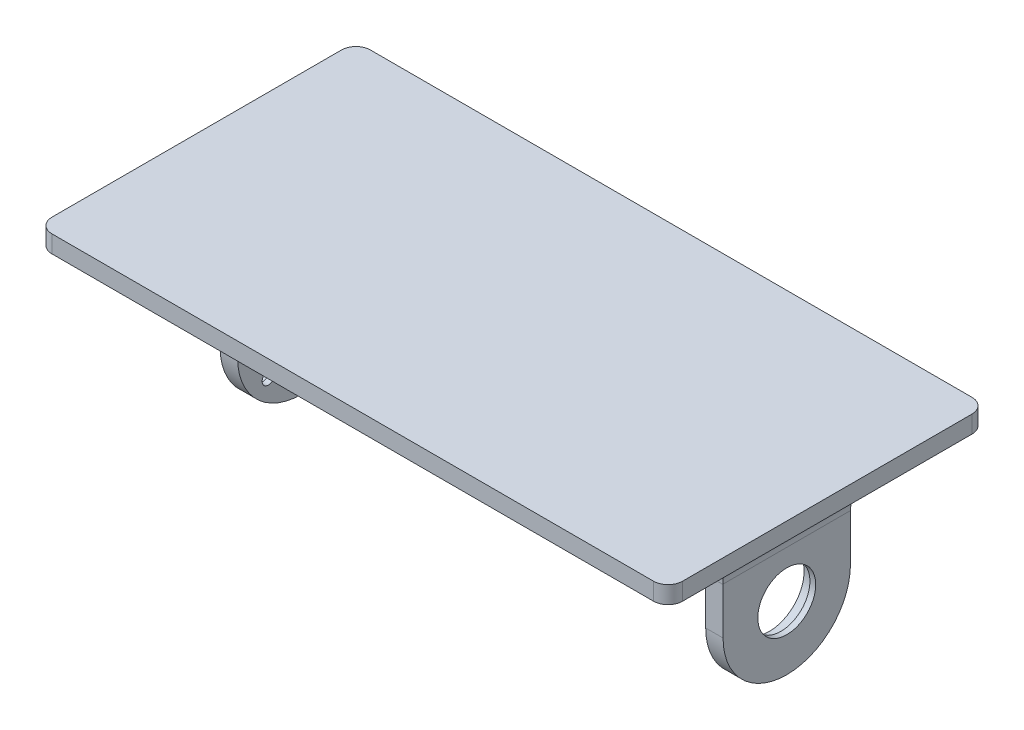
from build123d import *

# Parameters (mm, degrees)
SKETCH1_W           = 108.9
SKETCH1_H           = 55
BOSS_EXTRUDE1_DEPTH = 3
SKETCH5_W           = 3
SKETCH5_H           = 22
BOSS_EXTRUDE2_DEPTH = 27
SKETCH2_R           = 3
SKETCH2_R_2         = 1.1
CUT_EXTRUDE1_DEPTH  = 3
CIRPATTERN1_COUNT   = 4
FILLET3_R           = 11
SKETCH6_R           = 2
CUT_EXTRUDE5_DEPTH  = 2
CIRPATTERN2_COUNT   = 4
SKETCH7_R           = 5
CUT_EXTRUDE6_DEPTH  = 10
SKETCH7_5_R         = 6
SKETCH7_5_R_2       = 5
CUT_EXTRUDE7_DEPTH  = 2
FILLET4_R           = 8
FILETE1_R           = 2.5


# Some blends are built 0.0001 mm under size
with BuildPart() as part:
    # Sketch1 → Boss-Extrude1 (new body)
    with BuildSketch(Plane(origin=(0, 0, 0), x_dir=(1, 0, 0), z_dir=(0, 1, 0))):
        with Locations((-4.025, 0)):
            Rectangle(SKETCH1_W, SKETCH1_H)
    extrude(amount=BOSS_EXTRUDE1_DEPTH)

    # Sketch5 → Boss-Extrude2 (add)
    with BuildSketch(Plane.XZ):
        with Locations((-41.925, 0)):
            Rectangle(SKETCH5_W, SKETCH5_H)
        with Locations((41.925, 0)):
            Rectangle(SKETCH5_W, SKETCH5_H)
    extrude(amount=BOSS_EXTRUDE2_DEPTH)

    # Sketch2 → Cut-Extrude1 (cut)
    with BuildSketch(Plane.ZY.offset(43.425)):
        with Locations((0, -16)):
            Circle(SKETCH2_R)
        with Locations((-5.656854249, -21.656854249)):
            Circle(SKETCH2_R_2)
    cut_extrude1 = extrude(amount=-CUT_EXTRUDE1_DEPTH, mode=Mode.SUBTRACT)

    # CirPattern1: Cut-Extrude1 ×4 about axis
    cirpattern1_axis = Axis((0, -16, 0), (1, 0, 0))
    for i in range(1, CIRPATTERN1_COUNT):
        add(cut_extrude1.rotate(cirpattern1_axis, i * 360 / CIRPATTERN1_COUNT), mode=Mode.SUBTRACT)

    # Fillet3
    fillet3_edges = [part.edges().sort_by_distance(p)[0] for p in [
        (-41.925, -27, -11),
        (-41.925, -27, 11),
        (41.925, -27, -11),
        (41.925, -27, 11),
    ]]
    fillet(fillet3_edges, radius=FILLET3_R - 0.0001)  # a hair under: the kernel refuses the full size

    # Sketch6 → Cut-Extrude5 (cut)
    with BuildSketch(Plane.ZY.offset(43.425)):
        with Locations((5.656854249, -10.343145751)):
            Circle(SKETCH6_R)
    cut_extrude5 = extrude(amount=-CUT_EXTRUDE5_DEPTH, mode=Mode.SUBTRACT)

    # CirPattern2: Cut-Extrude5 ×4 about axis
    cirpattern2_axis = Axis((0, -16, 0), (1, 0, 0))
    for i in range(1, CIRPATTERN2_COUNT):
        add(cut_extrude5.rotate(cirpattern2_axis, i * 360 / CIRPATTERN2_COUNT), mode=Mode.SUBTRACT)

    # Sketch7 → Cut-Extrude6 (cut)
    with BuildSketch(Plane.ZY.offset(-40.425)):
        with Locations((0, -16)):
            Circle(SKETCH7_R)
    extrude(amount=-CUT_EXTRUDE6_DEPTH, mode=Mode.SUBTRACT)

    # Sketch7<5> → Cut-Extrude7 (cut)
    with BuildSketch(Plane.ZY.offset(-40.425)):
        with Locations((0, -16)):
            Circle(SKETCH7_5_R)
        with Locations((0, -16)):
            Circle(SKETCH7_5_R_2, mode=Mode.SUBTRACT)
    extrude(amount=-CUT_EXTRUDE7_DEPTH, mode=Mode.SUBTRACT)

    # Fillet4
    # the kernel refuses this fillet: 8 mm, written as the material it adds along each edge
    with BuildSketch(Plane(origin=(-43.425, 0, -11), x_dir=(0, -1, 0), z_dir=(0, 0, 1))) as fillet4_piece_1:
        with BuildLine():
            CenterArc((FILLET4_R, -FILLET4_R), FILLET4_R, 90, 90)
            Line((0, -FILLET4_R), (-FILLET4_R * 0.02, -FILLET4_R))
            Line((-FILLET4_R * 0.02, -FILLET4_R), (-FILLET4_R * 0.02, FILLET4_R * 0.02))
            Line((-FILLET4_R * 0.02, FILLET4_R * 0.02), (FILLET4_R, FILLET4_R * 0.02))
            Line((FILLET4_R, FILLET4_R * 0.02), (FILLET4_R, 0))
        make_face()
    extrude(amount=22)
    with BuildSketch(Plane(origin=(-40.425, 0, -11), x_dir=(0, 0, -1), z_dir=(-1, 0, 0)), Plane(origin=(43.425, 0, -11), x_dir=(0, 0, -1), z_dir=(-1, 0, 0)), Plane(origin=(40.425, 0, 11), x_dir=(0, 0, 1), z_dir=(1, 0, 0))) as fillet4_piece_2:
        with BuildLine():
            CenterArc((FILLET4_R, FILLET4_R), FILLET4_R, 180, 90)
            Line((0, FILLET4_R), (-FILLET4_R * 0.02, FILLET4_R))
            Line((-FILLET4_R * 0.02, FILLET4_R), (-FILLET4_R * 0.02, -FILLET4_R * 0.02))
            Line((-FILLET4_R * 0.02, -FILLET4_R * 0.02), (FILLET4_R, -FILLET4_R * 0.02))
            Line((FILLET4_R, -FILLET4_R * 0.02), (FILLET4_R, 0))
        make_face()
    extrude(amount=3)
    with BuildSketch(Plane(origin=(-40.425, 0, 11), x_dir=(1, 0, 0), z_dir=(0, 0, -1)), Plane(origin=(40.425, 0, -11), x_dir=(-1, 0, 0), z_dir=(0, 0, 1))) as fillet4_piece_3:
        with BuildLine():
            CenterArc((FILLET4_R, FILLET4_R), FILLET4_R, 180, 90)
            Line((0, FILLET4_R), (-FILLET4_R * 0.02, FILLET4_R))
            Line((-FILLET4_R * 0.02, FILLET4_R), (-FILLET4_R * 0.02, -FILLET4_R * 0.02))
            Line((-FILLET4_R * 0.02, -FILLET4_R * 0.02), (FILLET4_R, -FILLET4_R * 0.02))
            Line((FILLET4_R, -FILLET4_R * 0.02), (FILLET4_R, 0))
        make_face()
    extrude(amount=22)
    with BuildSketch(Plane(origin=(-43.425, 0, 11), x_dir=(0, -1, 0), z_dir=(1, 0, 0))) as fillet4_piece_4:
        with BuildLine():
            CenterArc((FILLET4_R, -FILLET4_R), FILLET4_R, 90, 90)
            Line((0, -FILLET4_R), (-FILLET4_R * 0.02, -FILLET4_R))
            Line((-FILLET4_R * 0.02, -FILLET4_R), (-FILLET4_R * 0.02, FILLET4_R * 0.02))
            Line((-FILLET4_R * 0.02, FILLET4_R * 0.02), (FILLET4_R, FILLET4_R * 0.02))
            Line((FILLET4_R, FILLET4_R * 0.02), (FILLET4_R, 0))
        make_face()
    extrude(amount=3)
    with BuildSketch(Plane(origin=(43.425, 0, 11), x_dir=(1, 0, 0), z_dir=(0, 0, -1))) as fillet4_piece_5:
        with BuildLine():
            CenterArc((8, 7.937253933), FILLET4_R, 180, 82.819244219)
            Line((0, 7.937253933), (-0.16, 7.937253933))
            Line((-0.16, 7.937253933), (-0.16, 0))
            Line((-0.16, 0), (0, -0.16))
            ThreePointArc((0, -0.16), (3.5, -0.16), (6.98, -0.158745079))
            Line((6.98, -0.158745079), (7, 0))
        make_face()
    extrude(amount=22)
    with BuildSketch(Plane(origin=(-43.425, 0, -31), x_dir=(0, -1, 0), z_dir=(0, 0, 1))) as fillet4_piece_6a_section:
        with BuildLine():
            CenterArc((FILLET4_R, -FILLET4_R), FILLET4_R, 90, 90)
            Line((0, -FILLET4_R), (-FILLET4_R * 0.02, -FILLET4_R))
            Line((-FILLET4_R * 0.02, -FILLET4_R), (-FILLET4_R * 0.02, FILLET4_R * 0.02))
            Line((-FILLET4_R * 0.02, FILLET4_R * 0.02), (FILLET4_R, FILLET4_R * 0.02))
            Line((FILLET4_R, FILLET4_R * 0.02), (FILLET4_R, 0))
        make_face()
    fillet4_piece_6a = extrude(amount=42, mode=Mode.PRIVATE)
    fillet4_piece_6a = split(fillet4_piece_6a, bisect_by=Plane(origin=(-45.236160914, -1.811160914, -11), z_dir=(0, 0, -1)), keep=Keep.TOP, mode=Mode.PRIVATE)
    fillet4_piece_6a = split(fillet4_piece_6a, bisect_by=Plane(origin=(-45.236160914, -1.811160914, -27.5), z_dir=(0, 0, 1)), keep=Keep.TOP, mode=Mode.PRIVATE)
    with BuildSketch(Plane(origin=(-40.425, 0, -11), x_dir=(0, 0, -1), z_dir=(-1, 0, 0))) as fillet4_piece_6b_section:
        with BuildLine():
            CenterArc((FILLET4_R, FILLET4_R), FILLET4_R, 180, 90)
            Line((0, FILLET4_R), (-FILLET4_R * 0.02, FILLET4_R))
            Line((-FILLET4_R * 0.02, FILLET4_R), (-FILLET4_R * 0.02, -FILLET4_R * 0.02))
            Line((-FILLET4_R * 0.02, -FILLET4_R * 0.02), (FILLET4_R, -FILLET4_R * 0.02))
            Line((FILLET4_R, -FILLET4_R * 0.02), (FILLET4_R, 0))
        make_face()
    fillet4_piece_6b = extrude(amount=23, mode=Mode.PRIVATE)
    fillet4_piece_6b = split(fillet4_piece_6b, bisect_by=Plane(origin=(-43.425, -1.811160914, -12.811160914), z_dir=(-1, 0, 0)), keep=Keep.TOP, mode=Mode.PRIVATE)
    fillet4_piece_6b = split(fillet4_piece_6b, bisect_by=Plane(origin=(-58.475, -1.811160914, -12.811160914), z_dir=(1, 0, 0)), keep=Keep.TOP, mode=Mode.PRIVATE)
    fillet4_piece_6 = fillet4_piece_6a & fillet4_piece_6b
    add(fillet4_piece_6)
    with BuildSketch(Plane(origin=(-63.425, 0, 11), x_dir=(0, -1, 0), z_dir=(1, 0, 0))) as fillet4_piece_7a_section:
        with BuildLine():
            CenterArc((FILLET4_R, -FILLET4_R), FILLET4_R, 90, 90)
            Line((0, -FILLET4_R), (-FILLET4_R * 0.02, -FILLET4_R))
            Line((-FILLET4_R * 0.02, -FILLET4_R), (-FILLET4_R * 0.02, FILLET4_R * 0.02))
            Line((-FILLET4_R * 0.02, FILLET4_R * 0.02), (FILLET4_R, FILLET4_R * 0.02))
            Line((FILLET4_R, FILLET4_R * 0.02), (FILLET4_R, 0))
        make_face()
    fillet4_piece_7a = extrude(amount=23, mode=Mode.PRIVATE)
    fillet4_piece_7a = split(fillet4_piece_7a, bisect_by=Plane(origin=(-43.425, -1.811160914, 12.811160914), z_dir=(-1, 0, 0)), keep=Keep.TOP, mode=Mode.PRIVATE)
    fillet4_piece_7a = split(fillet4_piece_7a, bisect_by=Plane(origin=(-58.475, -1.811160914, 12.811160914), z_dir=(1, 0, 0)), keep=Keep.TOP, mode=Mode.PRIVATE)
    with BuildSketch(Plane(origin=(-43.425, 0, -11), x_dir=(0, -1, 0), z_dir=(0, 0, 1))) as fillet4_piece_7b_section:
        with BuildLine():
            CenterArc((FILLET4_R, -FILLET4_R), FILLET4_R, 90, 90)
            Line((0, -FILLET4_R), (-FILLET4_R * 0.02, -FILLET4_R))
            Line((-FILLET4_R * 0.02, -FILLET4_R), (-FILLET4_R * 0.02, FILLET4_R * 0.02))
            Line((-FILLET4_R * 0.02, FILLET4_R * 0.02), (FILLET4_R, FILLET4_R * 0.02))
            Line((FILLET4_R, FILLET4_R * 0.02), (FILLET4_R, 0))
        make_face()
    fillet4_piece_7b = extrude(amount=42, mode=Mode.PRIVATE)
    fillet4_piece_7b = split(fillet4_piece_7b, bisect_by=Plane(origin=(-45.236160914, -1.811160914, 11), z_dir=(0, 0, 1)), keep=Keep.TOP, mode=Mode.PRIVATE)
    fillet4_piece_7b = split(fillet4_piece_7b, bisect_by=Plane(origin=(-45.236160914, -1.811160914, 27.5), z_dir=(0, 0, -1)), keep=Keep.TOP, mode=Mode.PRIVATE)
    fillet4_piece_7 = fillet4_piece_7a & fillet4_piece_7b
    add(fillet4_piece_7)
    with BuildSketch(Plane(origin=(-20.425, 0, -11), x_dir=(0, 0, -1), z_dir=(-1, 0, 0))) as fillet4_piece_8a_section:
        with BuildLine():
            CenterArc((FILLET4_R, FILLET4_R), FILLET4_R, 180, 90)
            Line((0, FILLET4_R), (-FILLET4_R * 0.02, FILLET4_R))
            Line((-FILLET4_R * 0.02, FILLET4_R), (-FILLET4_R * 0.02, -FILLET4_R * 0.02))
            Line((-FILLET4_R * 0.02, -FILLET4_R * 0.02), (FILLET4_R, -FILLET4_R * 0.02))
            Line((FILLET4_R, -FILLET4_R * 0.02), (FILLET4_R, 0))
        make_face()
    fillet4_piece_8a = extrude(amount=23, mode=Mode.PRIVATE)
    fillet4_piece_8a = split(fillet4_piece_8a, bisect_by=Plane(origin=(-40.425, -1.811160914, -12.811160914), z_dir=(1, 0, 0)), keep=Keep.TOP, mode=Mode.PRIVATE)
    with BuildSketch(Plane(origin=(-40.425, 0, 11), x_dir=(1, 0, 0), z_dir=(0, 0, -1))) as fillet4_piece_8b_section:
        with BuildLine():
            CenterArc((FILLET4_R, FILLET4_R), FILLET4_R, 180, 90)
            Line((0, FILLET4_R), (-FILLET4_R * 0.02, FILLET4_R))
            Line((-FILLET4_R * 0.02, FILLET4_R), (-FILLET4_R * 0.02, -FILLET4_R * 0.02))
            Line((-FILLET4_R * 0.02, -FILLET4_R * 0.02), (FILLET4_R, -FILLET4_R * 0.02))
            Line((FILLET4_R, -FILLET4_R * 0.02), (FILLET4_R, 0))
        make_face()
    fillet4_piece_8b = extrude(amount=42, mode=Mode.PRIVATE)
    fillet4_piece_8b = split(fillet4_piece_8b, bisect_by=Plane(origin=(-38.613839086, -1.811160914, -27.5), z_dir=(0, 0, 1)), keep=Keep.TOP, mode=Mode.PRIVATE)
    fillet4_piece_8b = split(fillet4_piece_8b, bisect_by=Plane(origin=(-38.613839086, -1.811160914, -11), z_dir=(0, 0, -1)), keep=Keep.TOP, mode=Mode.PRIVATE)
    fillet4_piece_8 = fillet4_piece_8a & fillet4_piece_8b
    add(fillet4_piece_8)
    with BuildSketch(Plane(origin=(-43.425, 0, 11), x_dir=(0, -1, 0), z_dir=(1, 0, 0))) as fillet4_piece_9a_section:
        with BuildLine():
            CenterArc((FILLET4_R, -FILLET4_R), FILLET4_R, 90, 90)
            Line((0, -FILLET4_R), (-FILLET4_R * 0.02, -FILLET4_R))
            Line((-FILLET4_R * 0.02, -FILLET4_R), (-FILLET4_R * 0.02, FILLET4_R * 0.02))
            Line((-FILLET4_R * 0.02, FILLET4_R * 0.02), (FILLET4_R, FILLET4_R * 0.02))
            Line((FILLET4_R, FILLET4_R * 0.02), (FILLET4_R, 0))
        make_face()
    fillet4_piece_9a = extrude(amount=23, mode=Mode.PRIVATE)
    fillet4_piece_9a = split(fillet4_piece_9a, bisect_by=Plane(origin=(-40.425, -1.811160914, 12.811160914), z_dir=(1, 0, 0)), keep=Keep.TOP, mode=Mode.PRIVATE)
    with BuildSketch(Plane(origin=(-40.425, 0, 31), x_dir=(1, 0, 0), z_dir=(0, 0, -1))) as fillet4_piece_9b_section:
        with BuildLine():
            CenterArc((FILLET4_R, FILLET4_R), FILLET4_R, 180, 90)
            Line((0, FILLET4_R), (-FILLET4_R * 0.02, FILLET4_R))
            Line((-FILLET4_R * 0.02, FILLET4_R), (-FILLET4_R * 0.02, -FILLET4_R * 0.02))
            Line((-FILLET4_R * 0.02, -FILLET4_R * 0.02), (FILLET4_R, -FILLET4_R * 0.02))
            Line((FILLET4_R, -FILLET4_R * 0.02), (FILLET4_R, 0))
        make_face()
    fillet4_piece_9b = extrude(amount=42, mode=Mode.PRIVATE)
    fillet4_piece_9b = split(fillet4_piece_9b, bisect_by=Plane(origin=(-38.613839086, -1.811160914, 11), z_dir=(0, 0, 1)), keep=Keep.TOP, mode=Mode.PRIVATE)
    fillet4_piece_9b = split(fillet4_piece_9b, bisect_by=Plane(origin=(-38.613839086, -1.811160914, 27.5), z_dir=(0, 0, -1)), keep=Keep.TOP, mode=Mode.PRIVATE)
    fillet4_piece_9 = fillet4_piece_9a & fillet4_piece_9b
    add(fillet4_piece_9)
    with BuildSketch(Plane(origin=(40.425, 0, -31), x_dir=(-1, 0, 0), z_dir=(0, 0, 1))) as fillet4_piece_10a_section:
        with BuildLine():
            CenterArc((FILLET4_R, FILLET4_R), FILLET4_R, 180, 90)
            Line((0, FILLET4_R), (-FILLET4_R * 0.02, FILLET4_R))
            Line((-FILLET4_R * 0.02, FILLET4_R), (-FILLET4_R * 0.02, -FILLET4_R * 0.02))
            Line((-FILLET4_R * 0.02, -FILLET4_R * 0.02), (FILLET4_R, -FILLET4_R * 0.02))
            Line((FILLET4_R, -FILLET4_R * 0.02), (FILLET4_R, 0))
        make_face()
    fillet4_piece_10a = extrude(amount=42, mode=Mode.PRIVATE)
    fillet4_piece_10a = split(fillet4_piece_10a, bisect_by=Plane(origin=(38.613839086, -1.811160914, -27.5), z_dir=(0, 0, 1)), keep=Keep.TOP, mode=Mode.PRIVATE)
    fillet4_piece_10a = split(fillet4_piece_10a, bisect_by=Plane(origin=(38.613839086, -1.811160914, -11), z_dir=(0, 0, -1)), keep=Keep.TOP, mode=Mode.PRIVATE)
    with BuildSketch(Plane(origin=(43.425, 0, -11), x_dir=(0, 0, -1), z_dir=(-1, 0, 0))) as fillet4_piece_10b_section:
        with BuildLine():
            CenterArc((FILLET4_R, FILLET4_R), FILLET4_R, 180, 90)
            Line((0, FILLET4_R), (-FILLET4_R * 0.02, FILLET4_R))
            Line((-FILLET4_R * 0.02, FILLET4_R), (-FILLET4_R * 0.02, -FILLET4_R * 0.02))
            Line((-FILLET4_R * 0.02, -FILLET4_R * 0.02), (FILLET4_R, -FILLET4_R * 0.02))
            Line((FILLET4_R, -FILLET4_R * 0.02), (FILLET4_R, 0))
        make_face()
    fillet4_piece_10b = extrude(amount=23, mode=Mode.PRIVATE)
    fillet4_piece_10b = split(fillet4_piece_10b, bisect_by=Plane(origin=(40.425, -1.811160914, -12.811160914), z_dir=(-1, 0, 0)), keep=Keep.TOP, mode=Mode.PRIVATE)
    fillet4_piece_10 = fillet4_piece_10a & fillet4_piece_10b
    add(fillet4_piece_10)
    with BuildSketch(Plane(origin=(40.425, 0, -11), x_dir=(-1, 0, 0), z_dir=(0, 0, 1))) as fillet4_piece_11a_section:
        with BuildLine():
            CenterArc((FILLET4_R, FILLET4_R), FILLET4_R, 180, 90)
            Line((0, FILLET4_R), (-FILLET4_R * 0.02, FILLET4_R))
            Line((-FILLET4_R * 0.02, FILLET4_R), (-FILLET4_R * 0.02, -FILLET4_R * 0.02))
            Line((-FILLET4_R * 0.02, -FILLET4_R * 0.02), (FILLET4_R, -FILLET4_R * 0.02))
            Line((FILLET4_R, -FILLET4_R * 0.02), (FILLET4_R, 0))
        make_face()
    fillet4_piece_11a = extrude(amount=42, mode=Mode.PRIVATE)
    fillet4_piece_11a = split(fillet4_piece_11a, bisect_by=Plane(origin=(38.613839086, -1.811160914, 27.5), z_dir=(0, 0, -1)), keep=Keep.TOP, mode=Mode.PRIVATE)
    fillet4_piece_11a = split(fillet4_piece_11a, bisect_by=Plane(origin=(38.613839086, -1.811160914, 11), z_dir=(0, 0, 1)), keep=Keep.TOP, mode=Mode.PRIVATE)
    with BuildSketch(Plane(origin=(20.425, 0, 11), x_dir=(0, 0, 1), z_dir=(1, 0, 0))) as fillet4_piece_11b_section:
        with BuildLine():
            CenterArc((FILLET4_R, FILLET4_R), FILLET4_R, 180, 90)
            Line((0, FILLET4_R), (-FILLET4_R * 0.02, FILLET4_R))
            Line((-FILLET4_R * 0.02, FILLET4_R), (-FILLET4_R * 0.02, -FILLET4_R * 0.02))
            Line((-FILLET4_R * 0.02, -FILLET4_R * 0.02), (FILLET4_R, -FILLET4_R * 0.02))
            Line((FILLET4_R, -FILLET4_R * 0.02), (FILLET4_R, 0))
        make_face()
    fillet4_piece_11b = extrude(amount=23, mode=Mode.PRIVATE)
    fillet4_piece_11b = split(fillet4_piece_11b, bisect_by=Plane(origin=(40.425, -1.811160914, 12.811160914), z_dir=(-1, 0, 0)), keep=Keep.TOP, mode=Mode.PRIVATE)
    fillet4_piece_11 = fillet4_piece_11a & fillet4_piece_11b
    add(fillet4_piece_11)
    with BuildSketch(Plane(origin=(63.425, 0, -11), x_dir=(0, 0, -1), z_dir=(-1, 0, 0))) as fillet4_piece_12a_section:
        with BuildLine():
            CenterArc((FILLET4_R, FILLET4_R), FILLET4_R, 180, 90)
            Line((0, FILLET4_R), (-FILLET4_R * 0.02, FILLET4_R))
            Line((-FILLET4_R * 0.02, FILLET4_R), (-FILLET4_R * 0.02, -FILLET4_R * 0.02))
            Line((-FILLET4_R * 0.02, -FILLET4_R * 0.02), (FILLET4_R, -FILLET4_R * 0.02))
            Line((FILLET4_R, -FILLET4_R * 0.02), (FILLET4_R, 0))
        make_face()
    fillet4_piece_12a = extrude(amount=23, mode=Mode.PRIVATE)
    fillet4_piece_12a = split(fillet4_piece_12a, bisect_by=Plane(origin=(50.425, -1.811160914, -12.811160914), z_dir=(-1, 0, 0)), keep=Keep.TOP, mode=Mode.PRIVATE)
    fillet4_piece_12a = split(fillet4_piece_12a, bisect_by=Plane(origin=(43.425, -1.811160914, -12.811160914), z_dir=(1, 0, 0)), keep=Keep.TOP, mode=Mode.PRIVATE)
    with BuildSketch(Plane(origin=(43.425, 0, 11), x_dir=(1, 0, 0), z_dir=(0, 0, -1))) as fillet4_piece_12b_section:
        with BuildLine():
            CenterArc((8, 7.937253933), FILLET4_R, 180, 82.819244219)
            Line((0, 7.937253933), (-0.16, 7.937253933))
            Line((-0.16, 7.937253933), (-0.16, 0))
            Line((-0.16, 0), (0, -0.16))
            ThreePointArc((0, -0.16), (3.5, -0.16), (6.98, -0.158745079))
            Line((6.98, -0.158745079), (7, 0))
        make_face()
    fillet4_piece_12b = extrude(amount=41.843134833, mode=Mode.PRIVATE)
    fillet4_piece_12b = split(fillet4_piece_12b, bisect_by=Plane(origin=(45.12528275, -1.827589543, -27.5), z_dir=(0, 0, 1)), keep=Keep.TOP, mode=Mode.PRIVATE)
    fillet4_piece_12b = split(fillet4_piece_12b, bisect_by=Plane(origin=(45.12528275, -1.827589543, -11), z_dir=(0, 0, -1)), keep=Keep.TOP, mode=Mode.PRIVATE)
    fillet4_piece_12 = fillet4_piece_12a & fillet4_piece_12b
    add(fillet4_piece_12)
    with BuildSketch(Plane(origin=(43.425, 0, 30.843134833), x_dir=(1, 0, 0), z_dir=(0, 0, -1))) as fillet4_piece_13a_section:
        with BuildLine():
            CenterArc((8, 7.937253933), FILLET4_R, 180, 82.819244219)
            Line((0, 7.937253933), (-0.16, 7.937253933))
            Line((-0.16, 7.937253933), (-0.16, 0))
            Line((-0.16, 0), (0, -0.16))
            ThreePointArc((0, -0.16), (3.5, -0.16), (6.98, -0.158745079))
            Line((6.98, -0.158745079), (7, 0))
        make_face()
    fillet4_piece_13a = extrude(amount=41.843134833, mode=Mode.PRIVATE)
    fillet4_piece_13a = split(fillet4_piece_13a, bisect_by=Plane(origin=(45.12528275, -1.827589543, 27.5), z_dir=(0, 0, -1)), keep=Keep.TOP, mode=Mode.PRIVATE)
    fillet4_piece_13a = split(fillet4_piece_13a, bisect_by=Plane(origin=(45.12528275, -1.827589543, 11), z_dir=(0, 0, 1)), keep=Keep.TOP, mode=Mode.PRIVATE)
    with BuildSketch(Plane(origin=(40.425, 0, 11), x_dir=(0, 0, 1), z_dir=(1, 0, 0))) as fillet4_piece_13b_section:
        with BuildLine():
            CenterArc((FILLET4_R, FILLET4_R), FILLET4_R, 180, 90)
            Line((0, FILLET4_R), (-FILLET4_R * 0.02, FILLET4_R))
            Line((-FILLET4_R * 0.02, FILLET4_R), (-FILLET4_R * 0.02, -FILLET4_R * 0.02))
            Line((-FILLET4_R * 0.02, -FILLET4_R * 0.02), (FILLET4_R, -FILLET4_R * 0.02))
            Line((FILLET4_R, -FILLET4_R * 0.02), (FILLET4_R, 0))
        make_face()
    fillet4_piece_13b = extrude(amount=23, mode=Mode.PRIVATE)
    fillet4_piece_13b = split(fillet4_piece_13b, bisect_by=Plane(origin=(50.425, -1.811160914, 12.811160914), z_dir=(-1, 0, 0)), keep=Keep.TOP, mode=Mode.PRIVATE)
    fillet4_piece_13b = split(fillet4_piece_13b, bisect_by=Plane(origin=(43.425, -1.811160914, 12.811160914), z_dir=(1, 0, 0)), keep=Keep.TOP, mode=Mode.PRIVATE)
    fillet4_piece_13 = fillet4_piece_13a & fillet4_piece_13b
    add(fillet4_piece_13)

    # Filete1
    filete1_edges = [part.edges().sort_by_distance(p)[0] for p in [
        (50.425, 1.5, -27.5),
        (-58.475, 1.5, -27.5),
        (-58.475, 1.5, 27.5),
        (50.425, 1.5, 27.5),
    ]]
    fillet(filete1_edges, radius=FILETE1_R)


solid = part.part
